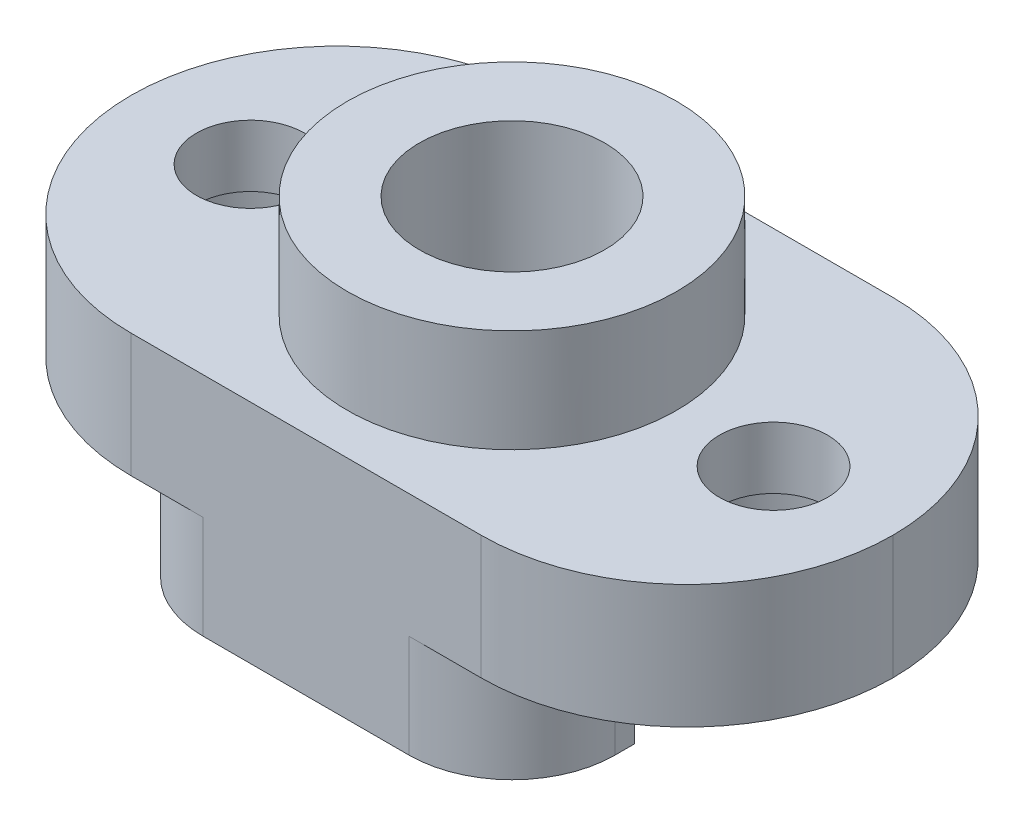
from build123d import *

# Parameters (mm, degrees)
BOSS_EXTRUDE1_DEPTH     = 11
SKETCH2_W               = 37
SKETCH2_H               = 20
BOSS_EXTRUDE2_DEPTH     = 6
SKETCH8_R               = 8
BOSS_EXTRUDE3_DEPTH     = 5
CUT_EXTRUDE1_DEPTH      = 24.732888573
CUT_EXTRUDE1_DEPTH_BACK = 3
SKETCH4_R               = 4.875
SKETCH5_R               = 2.625
CUT_EXTRUDE2_DEPTH      = 24.732888573
CUT_EXTRUDE3_DEPTH      = 6
SKETCH7_R               = 4.5
CUT_EXTRUDE4_DEPTH      = 24.286262044
FILLET2_R               = 10


with BuildPart() as part:
    # Sketch1 → Boss-Extrude1 (new body)
    with BuildSketch(Plane(origin=(0, 0, 0), x_dir=(1, 0, 0), z_dir=(0, 1, 0))):
        with BuildLine():
            Line((-5, -10), (5, -10))
            ThreePointArc((5, -10), (8.535533906, -8.535533906), (10, -5))
            Line((10, -5), (10, 5))
            ThreePointArc((10, 5), (8.535533906, 8.535533906), (5, 10))
            Line((5, 10), (-5, 10))
            ThreePointArc((-5, 10), (-8.535533906, 8.535533906), (-10, 5))
            Line((-10, 5), (-10, -5))
            ThreePointArc((-10, -5), (-8.535533906, -8.535533906), (-5, -10))
        make_face()
    extrude(amount=-BOSS_EXTRUDE1_DEPTH)

    # Sketch2 → Boss-Extrude2 (add)
    with BuildSketch(Plane(origin=(0, 0, 0), x_dir=(1, 0, 0), z_dir=(0, 1, 0))):
        Rectangle(SKETCH2_W, SKETCH2_H)
    extrude(amount=-BOSS_EXTRUDE2_DEPTH)

    # Sketch8 → Boss-Extrude3 (add)
    with BuildSketch(Plane(origin=(0, 0, 0), x_dir=(1, 0, 0), z_dir=(0, 1, 0))):
        with Locations(Location((0, 0, 0), (0, 0, 90))):
            Circle(SKETCH8_R)
    extrude(amount=BOSS_EXTRUDE3_DEPTH)

    # Sketch4 → Cut-Extrude1 (cut, two sides: drawn at the far end of the back side and taken through both)
    with BuildSketch(Plane(origin=(0, -6, 0), x_dir=(-1, 0, 0), z_dir=(0, -1, 0)).offset(-CUT_EXTRUDE1_DEPTH_BACK)):
        with Locations(Location((-12.7, 0, 0), (0, 0, 303.631277448))):
            Circle(SKETCH4_R)
        with Locations(Location((12.7, 0, 0), (0, 0, 270))):
            Circle(SKETCH4_R)
    extrude(amount=CUT_EXTRUDE1_DEPTH + CUT_EXTRUDE1_DEPTH_BACK, mode=Mode.SUBTRACT)

    # Sketch5 → Cut-Extrude2 (cut, through all)
    with BuildSketch(Plane(origin=(0, -6, 0), x_dir=(-1, 0, 0), z_dir=(0, -1, 0))):
        with Locations(Location((-12.7, 0, 0), (0, 0, 90))):
            Circle(SKETCH5_R)
        with Locations(Location((12.7, 0, 0), (0, 0, 90))):
            Circle(SKETCH5_R)
    extrude(amount=-CUT_EXTRUDE2_DEPTH, mode=Mode.SUBTRACT)

    # Sketch6 → Cut-Extrude3 (cut)
    with BuildSketch(Plane.XZ.offset(11)):
        Polygon((7, -4.041451884), (7, 4.041451884), (0, 8.082903769), (-7, 4.041451884), (-7, -4.041451884), (0, -8.082903769), align=None)
    extrude(amount=-CUT_EXTRUDE3_DEPTH, mode=Mode.SUBTRACT)

    # Sketch7 → Cut-Extrude4 (cut, through all)
    with BuildSketch(Plane.XZ.offset(5)):
        with Locations(Location((0, 0, 0), (0, 0, 270))):
            Circle(SKETCH7_R)
    extrude(amount=-CUT_EXTRUDE4_DEPTH, mode=Mode.SUBTRACT)

    # Fillet2
    fillet2_edges = [part.edges().sort_by_distance(p)[0] for p in [
        (-18.5, -3, 10),
        (-18.5, -3, -10),
        (18.5, -3, -10),
        (18.5, -3, 10),
    ]]
    fillet(fillet2_edges, radius=FILLET2_R - 0.0001)  # a hair under: the kernel refuses the full size


solid = part.part
